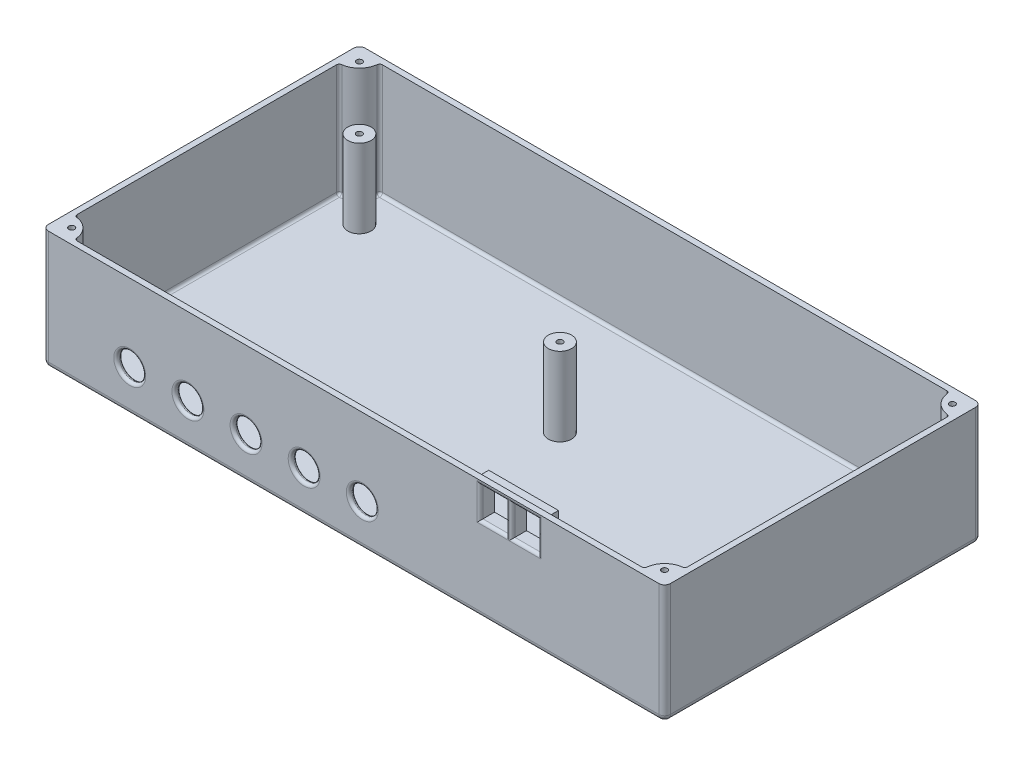
from build123d import *

# Parameters (mm, degrees)
SKETCH2_W                           = 214
SKETCH2_H                           = 109
BOSS_EXTRUDE1_DEPTH                 = 41
CUT_EXTRUDE1_DEPTH                  = 39
SKETCH4_R                           = 4.5
CUT_EXTRUDE2_DEPTH                  = 3
SKETCH5_R                           = 4
BOSS_EXTRUDE2_DEPTH                 = 27
SKETCH7_W                           = 24
SKETCH7_H                           = 13.5
BOSS_EXTRUDE5_DEPTH                 = 5
SKETCH8_W                           = 9
SKETCH8_H                           = 10.5
CUT_EXTRUDE3_DEPTH                  = 5
FILLET1_R                           = 2
FILLET2_R                           = 1
F_2_0MM_DOWEL_HOLE1_D               = 2
F_2_0MM_DOWEL_HOLE1_DEPTH           = 20
F_2_0MM_DOWEL_HOLE1_TIP             = 0.600860619
F_2_0MM_DOWEL_HOLE1_ON_FACE_2_D     = 2
F_2_0MM_DOWEL_HOLE1_ON_FACE_2_DEPTH = 20
F_2_0MM_DOWEL_HOLE1_ON_FACE_2_TIP   = 0.600860619
FILLET4_R                           = 1
FILLET5_R                           = 1


with BuildPart() as part:
    # Sketch2 → Boss-Extrude1 (new body)
    with BuildSketch(Plane(origin=(0, 0, 0), x_dir=(1, 0, 0), z_dir=(0, 1, 0))):
        Rectangle(SKETCH2_W, SKETCH2_H)
    extrude(amount=BOSS_EXTRUDE1_DEPTH)

    # Sketch3 → Cut-Extrude1 (cut)
    with BuildSketch(Plane(origin=(0, 41, 0), x_dir=(1, 0, 0), z_dir=(0, 1, 0))):
        with BuildLine():
            Line((98, 52.5), (-98, 52.5))
            ThreePointArc((-98, 52.5), (-100.050252532, 47.550252532), (-105, 45.5))
            Line((-105, 45.5), (-105, -45.5))
            ThreePointArc((-105, -45.5), (-100.050252532, -47.550252532), (-98, -52.5))
            Line((-98, -52.5), (98, -52.5))
            ThreePointArc((98, -52.5), (100.050252532, -47.550252532), (105, -45.5))
            Line((105, -45.5), (105, 45.5))
            ThreePointArc((105, 45.5), (100.050252532, 47.550252532), (98, 52.5))
        make_face()
    extrude(amount=-CUT_EXTRUDE1_DEPTH, mode=Mode.SUBTRACT)

    # Sketch4 → Cut-Extrude2 (cut)
    with BuildSketch(Plane.XY.offset(54.5)):
        with Locations((-77, 14.5)):
            Circle(SKETCH4_R)
        with Locations((-57, 14.5)):
            Circle(SKETCH4_R)
        with Locations((-37, 14.5)):
            Circle(SKETCH4_R)
        with Locations((-17, 14.5)):
            Circle(SKETCH4_R)
        with Locations((3, 14.5)):
            Circle(SKETCH4_R)
    extrude(amount=-CUT_EXTRUDE2_DEPTH, mode=Mode.SUBTRACT)

    # Sketch5 → Boss-Extrude2 (add)
    with BuildSketch(Plane(origin=(0, 2, 0), x_dir=(1, 0, 0), z_dir=(0, 1, 0))):
        with Locations(Location((-92.5, 40, 0), (0, 0, 270))):
            Circle(SKETCH5_R)
        with Locations(Location((4, 12.5, 0), (0, 0, 270))):
            Circle(SKETCH5_R)
    extrude(amount=BOSS_EXTRUDE2_DEPTH)

    # Sketch7 → Boss-Extrude5 (add)
    with BuildSketch(Plane.XY.offset(54.5)):
        with Locations((53.5, 33.75)):
            Rectangle(SKETCH7_W, SKETCH7_H)
    extrude(amount=-BOSS_EXTRUDE5_DEPTH)

    # Sketch8 → Cut-Extrude3 (cut)
    with BuildSketch(Plane.XY.offset(54.5)):
        with Locations((48, 34.25)):
            Rectangle(SKETCH8_W, SKETCH8_H)
        with Locations((59, 34.25)):
            Rectangle(SKETCH8_W, SKETCH8_H)
    extrude(amount=-CUT_EXTRUDE3_DEPTH, mode=Mode.SUBTRACT)

    # Fillet1
    fillet1_edges = [part.edges().sort_by_distance(p)[0] for p in [
        (0, 0, -54.5),
        (107, 0, 0),
        (0, 0, 54.5),
        (-107, 0, 0),
        (-107, 20.5, -54.5),
        (107, 20.5, -54.5),
        (107, 20.5, 54.5),
        (-107, 20.5, 54.5),
    ]]
    fillet(fillet1_edges, radius=FILLET1_R)

    # Fillet2
    fillet2_edges = [part.edges().sort_by_distance(p)[0] for p in [
        (43.5, 34.25, 54.5),
        (48, 29, 54.5),
        (52.5, 34.25, 54.5),
        (48, 39.5, 54.5),
        (54.5, 34.25, 54.5),
        (59, 29, 54.5),
        (63.5, 34.25, 54.5),
        (59, 39.5, 54.5),
    ]]
    fillet(fillet2_edges, radius=FILLET2_R - 0.0001)  # a hair under: the kernel refuses the full size

    # Ø2.0mm Dowel Hole1
    with Locations(Plane(origin=(-102, 41, 49.5), x_dir=(0, 0, 1), z_dir=(0, 1, 0))):
        with Locations((0, 0), (-99, 204), (0, 204), (-99, 0)):
            Hole(F_2_0MM_DOWEL_HOLE1_D / 2, depth=F_2_0MM_DOWEL_HOLE1_DEPTH)
            with Locations((0, 0, -(F_2_0MM_DOWEL_HOLE1_DEPTH + F_2_0MM_DOWEL_HOLE1_TIP / 2))):  # 118° drill point
                Cone(0, F_2_0MM_DOWEL_HOLE1_D / 2, F_2_0MM_DOWEL_HOLE1_TIP, mode=Mode.SUBTRACT)

    # Ø2.0mm Dowel Hole1 on face 2
    with Locations(Plane(origin=(-92.5, 29, -40), x_dir=(0, 0, 1), z_dir=(0, 1, 0))):
        with Locations((0, 0), (27.5, 96.5)):
            Hole(F_2_0MM_DOWEL_HOLE1_ON_FACE_2_D / 2, depth=F_2_0MM_DOWEL_HOLE1_ON_FACE_2_DEPTH)
            with Locations((0, 0, -(F_2_0MM_DOWEL_HOLE1_ON_FACE_2_DEPTH + F_2_0MM_DOWEL_HOLE1_ON_FACE_2_TIP / 2))):  # 118° drill point
                Cone(0, F_2_0MM_DOWEL_HOLE1_ON_FACE_2_D / 2, F_2_0MM_DOWEL_HOLE1_ON_FACE_2_TIP, mode=Mode.SUBTRACT)

    # Fillet4
    fillet4_edges = [part.edges().sort_by_distance(p)[0] for p in [
        (-81.5, 14.5, 52.5),
        (-81.5, 14.5, 54.5),
        (-61.5, 14.5, 52.5),
        (-61.5, 14.5, 54.5),
        (-41.5, 14.5, 52.5),
        (-41.5, 14.5, 54.5),
        (-21.5, 14.5, 52.5),
        (-21.5, 14.5, 54.5),
        (-1.5, 14.5, 52.5),
        (-1.5, 14.5, 54.5),
    ]]
    fillet(fillet4_edges, radius=FILLET4_R - 0.0001)  # a hair under: the kernel refuses the full size

    # Fillet5
    fillet5_edges = [part.edges().sort_by_distance(p)[0] for p in [
        (100.050252532, 2, -47.550252532),
        (98, 21.5, -52.5),
        (105, 2, 0),
        (105, 21.5, -45.5),
        (100.050252532, 2, 47.550252532),
        (105, 21.5, 45.5),
        (0, 2, 52.5),
        (98, 21.5, 52.5),
        (-100.050252532, 2, 47.550252532),
        (-98, 21.5, 52.5),
        (-105, 2, 0),
        (-105, 21.5, 45.5),
        (-100.050252532, 2, -47.550252532),
        (-105, 21.5, -45.5),
        (0, 2, -52.5),
        (-98, 21.5, -52.5),
    ]]
    fillet(fillet5_edges, radius=FILLET5_R)


solid = part.part
